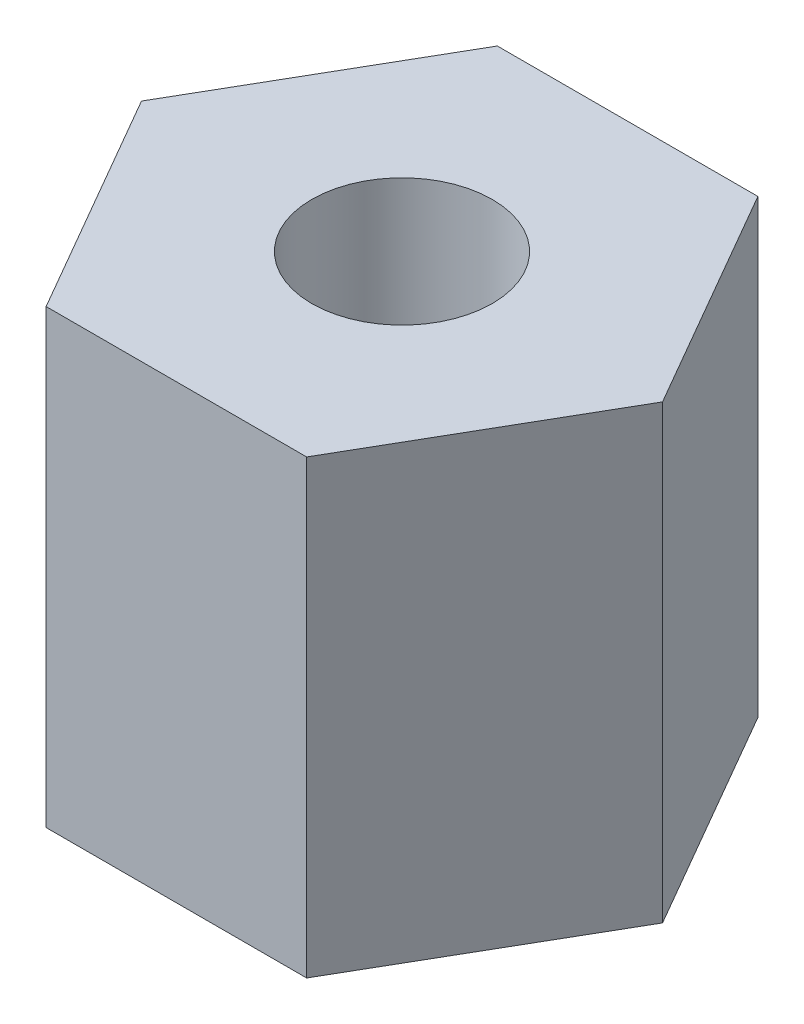
from build123d import *

# Parameters (mm, degrees)
BOSS_EXTRUDE1_DEPTH     = 50
CUT_EXTRUDE1_DEPTH      = 63.915286961
CUT_EXTRUDE1_DEPTH_BACK = 63.915286961
SKETCH3_R               = 10


with BuildPart() as part:
    # Sketch1 → Boss-Extrude1 (new body)
    with BuildSketch(Plane(origin=(0, 0, 0), x_dir=(1, 0, 0), z_dir=(0, 1, 0))):
        Polygon((-14.43375673, 25), (-28.867513459, 0), (-14.43375673, -25), (14.43375673, -25), (28.867513459, 0), (14.43375673, 25), align=None)
    extrude(amount=BOSS_EXTRUDE1_DEPTH)

    # Sketch3 → Cut-Extrude1 (cut, two sides: drawn at the far end of the back side and taken through both)
    with BuildSketch(Plane(origin=(0, 50, 0), x_dir=(1, 0, 0), z_dir=(0, 1, 0)).offset(-CUT_EXTRUDE1_DEPTH_BACK)):
        Circle(SKETCH3_R)
    extrude(amount=CUT_EXTRUDE1_DEPTH + CUT_EXTRUDE1_DEPTH_BACK, mode=Mode.SUBTRACT)


solid = part.part
